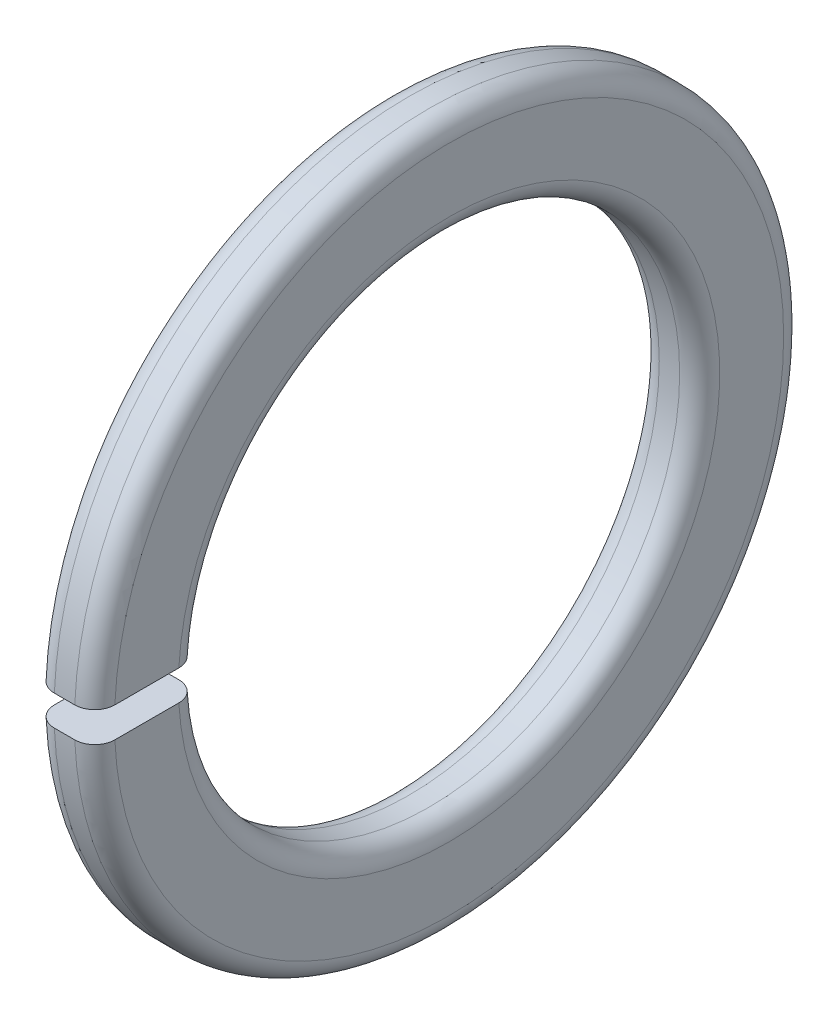
from build123d import *

# Parameters (mm, degrees)
SKETCH2_W = 4
SKETCH2_H = 47.838
GAP_DEPTH = 67.807335067


with BuildPart() as part:
    # Sketch1 → Base-Revolve (revolve)
    with BuildSketch(Plane.XY):
        with BuildLine():
            Line((0, 35.8), (0, 44.25))
            ThreePointArc((0, 44.25), (-0.77616703, 46.12383297), (-2.65, 46.9))
            Line((-2.65, 46.9), (-5.35, 46.9))
            ThreePointArc((-5.35, 46.9), (-7.22383297, 46.12383297), (-8, 44.25))
            Line((-8, 44.25), (-8, 35.8))
            ThreePointArc((-8, 35.8), (-7.22383297, 33.92616703), (-5.35, 33.15))
            Line((-5.35, 33.15), (-2.65, 33.15))
            ThreePointArc((-2.65, 33.15), (-0.77616703, 33.92616703), (0, 35.8))
        make_face()
    revolve(axis=Axis((-34.925, 0, 0), (1, 0, 0)))

    # Sketch2 → Gap (cut, through all)
    with BuildSketch(Plane(origin=(0, 0, 0), x_dir=(0, -1, 0), z_dir=(-1, 0, 0))):
        with Locations((0, 23.919)):
            Rectangle(SKETCH2_W, SKETCH2_H)
    extrude(amount=GAP_DEPTH, mode=Mode.SUBTRACT)


solid = part.part
